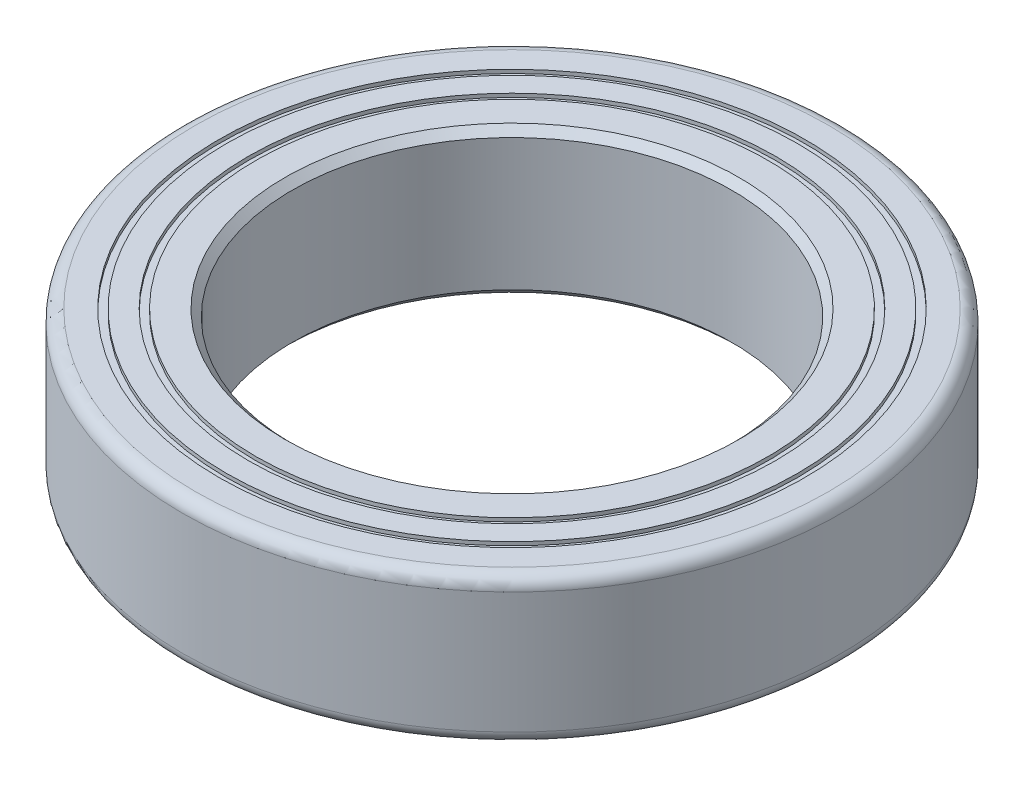
from build123d import *

# Parameters (mm, degrees)
FILLET2_R     = 0.344
CHAMFER2_SIZE = 0.2


with BuildPart() as part:
    # Sketch1 → Revolve1 (revolve)
    with BuildSketch(Plane.XY):
        Polygon((9, 0), (9, 4), (8, 4), (8, 3.9), (7.8, 3.9), (7.8, 4), (7.2, 4), (7.2, 3.9), (7, 3.9), (7, 4), (6, 4), (6, 0), (7, 0), (7, 0.1), (7.2, 0.1), (7.2, 0), (7.8, 0), (7.8, 0.1), (8, 0.1), (8, 0), align=None)
    revolve(axis=Axis((0, 2, 0), (0, -1, 0)))

    # Fillet2
    fillet2_edges = [part.edges().sort_by_distance(p)[0] for p in [
        (-9, 0, 0),
        (-9, 4, 0),
    ]]
    fillet(fillet2_edges, radius=FILLET2_R)

    # Chamfer2
    chamfer2_edges = [part.edges().sort_by_distance(p)[0] for p in [
        (-6, 0, 0),
        (-6, 4, 0),
    ]]
    chamfer(chamfer2_edges, length=CHAMFER2_SIZE)


solid = part.part
